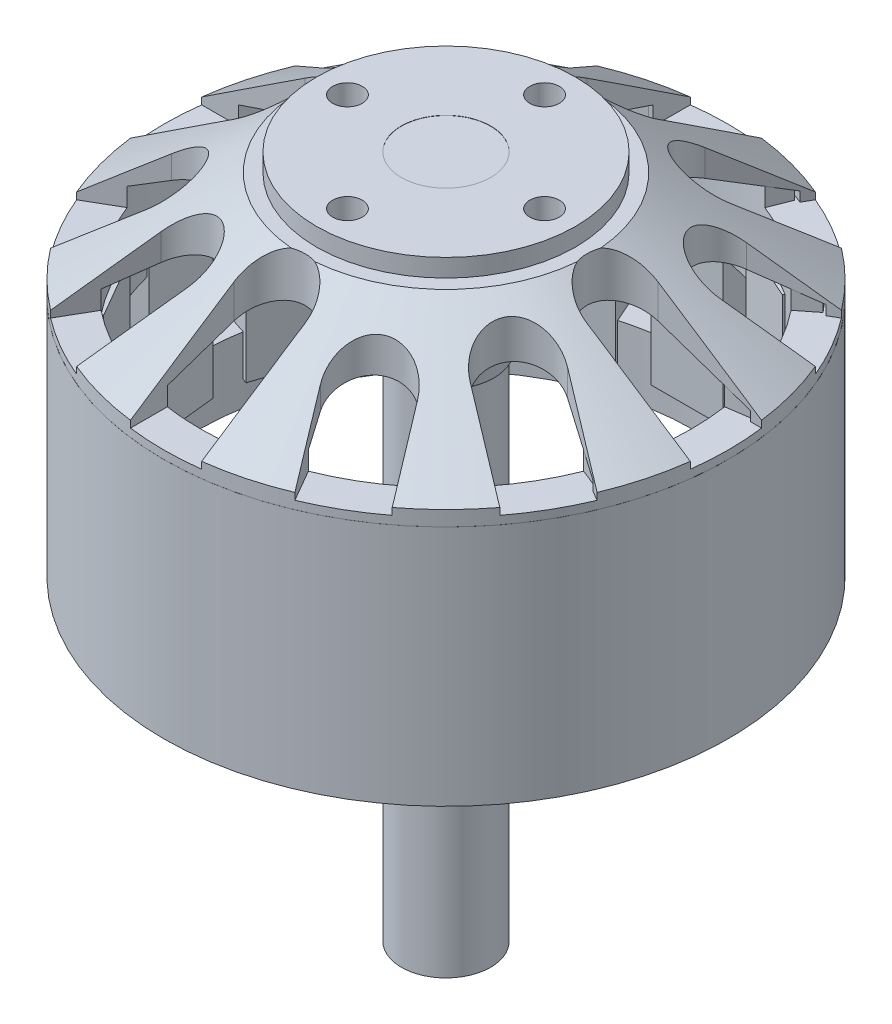
from build123d import *

# Parameters (mm, degrees)
SKETCH1_R               = 31.5
BOSS_EXTRUDE1_DEPTH     = 27
SKETCH2_R               = 16
BOSS_EXTRUDE2_DEPTH     = 12
SKETCH3_R               = 14.45
BOSS_EXTRUDE3_DEPTH     = 2
SKETCH5_R               = 31.495
BOSS_EXTRUDE5_DEPTH     = 1.68
SKETCH4_R               = 30.25
CUT_EXTRUDE3_DEPTH      = 29
SKETCH6_R               = 30.25
CUT_EXTRUDE4_DEPTH      = 5
CUT_EXTRUDE4_DRAFT      = -71
SKETCH7_R               = 7.5
BOSS_EXTRUDE6_DEPTH     = 12.192
BOSS_EXTRUDE6_TAPER     = 10
SKETCH8_R               = 4.98
BOSS_EXTRUDE7_DEPTH     = 57.15
SKETCH9_W               = 8
SKETCH9_H               = 3.077449872
BOSS_EXTRUDE8_DEPTH     = 23
SKETCH9_2_W             = 8
SKETCH9_2_H             = 3.077449872
CUT_EXTRUDE5_DEPTH      = 3
CIRPATTERN2_COUNT       = 15
CUT_EXTRUDE6_DEPTH      = 13.081
CIRPATTERN4_COUNT       = 4
SKETCH11_R              = 1.651
CUT_EXTRUDE7_DEPTH      = 7
CIRPATTERN5_COUNT       = 4
SKETCH11_3_R            = 4.98475
CUT_EXTRUDE8_DEPTH      = 0.0254
BOSS_EXTRUDE9_START     = -8.89
SKETCH12_R              = 30.25
SKETCH12_R_2            = 27.41332392
BOSS_EXTRUDE9_DEPTH     = 8.89
SKETCH13_R              = 30.25
SKETCH13_R_2            = 27.686
BOSS_EXTRUDE10_DEPTH    = 7.62
SKETCH13_2_R            = 30.25
SKETCH13_2_R_2          = 27.686
CUT_EXTRUDE9_DEPTH      = 0.254
EXTRUDE_THIN1_OUTLINE_W = 2.54
EXTRUDE_THIN1_OUTLINE_H = 2.93573008
EXTRUDE_THIN1_DEPTH     = 2.082149812
EXTRUDE_THIN1_3_DEPTH   = 0.930438526
EXTRUDE_THIN1_START     = 28.849438526
EXTRUDE_THIN1_4_DEPTH   = 1.127307378
CIRPATTERN8_COUNT       = 12


with BuildPart() as part:
    # Sketch1 → Boss-Extrude1 (new body)
    with BuildSketch(Plane(origin=(0, 0, 0), x_dir=(1, 0, 0), z_dir=(0, 1, 0))):
        with Locations(Location((0, 0, 0), (0, 0, 270))):
            Circle(SKETCH1_R)
    extrude(amount=BOSS_EXTRUDE1_DEPTH)

    # Sketch2 → Boss-Extrude2 (add)
    with BuildSketch(Plane(origin=(0, 27, 0), x_dir=(1, 0, 0), z_dir=(0, 1, 0))):
        with Locations(Location((0, 0, 0), (0, 0, 270))):
            Circle(SKETCH2_R)
    extrude(amount=BOSS_EXTRUDE2_DEPTH)

    # Sketch3 → Boss-Extrude3 (add)
    with BuildSketch(Plane(origin=(0, 39, 0), x_dir=(1, 0, 0), z_dir=(0, 1, 0))):
        with Locations(Location((0, 0, 0), (0, 0, 270))):
            Circle(SKETCH3_R)
    extrude(amount=BOSS_EXTRUDE3_DEPTH)

    # Sketch5 → Boss-Extrude5 (add)
    with BuildSketch(Plane(origin=(0, 27, 0), x_dir=(1, 0, 0), z_dir=(0, 1, 0))):
        with Locations(Location((0, 0, 0), (0, 0, 270))):
            Circle(SKETCH5_R)
    extrude(amount=BOSS_EXTRUDE5_DEPTH)

    # loft up to a face of the part (loft2)
    loft([Face(Wire([part.edges().sort_by_distance((22.958866921, 28.68, -21.559811101))[0]])), Face(Wire([part.edges().sort_by_distance((11.663498039, 39, -10.952753695))[0]]))])

    # Sketch4 → Cut-Extrude3 (cut)
    with BuildSketch(Plane.XZ):
        with Locations(Location((0, 0, 0), (0, 0, 270))):
            Circle(SKETCH4_R)
    extrude(amount=-CUT_EXTRUDE3_DEPTH, mode=Mode.SUBTRACT)


with BuildPart() as cut_extrude4_tool:
    # Sketch6 → Cut-Extrude4 (with draft: the straight prism first)
    with BuildSketch(Plane.XZ.offset(-29)):
        with Locations(Location((0, 0, 0), (0, 0, 270))):
            Circle(SKETCH6_R)
    extrude(amount=-CUT_EXTRUDE4_DEPTH)
    # Cut-Extrude4: the draft: its side faces are tilted about the plane it starts from
    cut_extrude4_sides = [cut_extrude4_tool.faces().sort_by_distance(p)[0] for p in [
        (0, 31.5, 30.25),
    ]]
    draft(cut_extrude4_sides, Plane.XZ.offset(-29), CUT_EXTRUDE4_DRAFT)


with BuildPart() as part_1:
    add(part.part)

    # Cut-Extrude4: cut by cut_extrude4_tool
    add(cut_extrude4_tool.part, mode=Mode.SUBTRACT)

    # Sketch7 → Boss-Extrude6 (add)
    with BuildSketch(Plane.XZ.offset(-34)):
        Circle(SKETCH7_R)
    extrude(amount=BOSS_EXTRUDE6_DEPTH, taper=BOSS_EXTRUDE6_TAPER)

    # Sketch8 → Boss-Extrude7 (add)
    with BuildSketch(Plane.XZ.offset(-21.808)):
        with Locations(Location((0, 0, 0), (0, 0, 270))):
            Circle(SKETCH8_R)
    extrude(amount=BOSS_EXTRUDE7_DEPTH)

    # Sketch10 → Cut-Extrude6 (cut)
    with BuildSketch(Plane(origin=(0, 41, 0), x_dir=(1, 0, 0), z_dir=(0, 1, 0))):
        with BuildLine():
            Line((-3.9751, 19.6951), (-3.9751, 33.358975787))
            Line((-3.9751, 33.358975787), (3.9751, 33.358975787))
            Line((3.9751, 33.358975787), (3.9751, 19.6951))
            ThreePointArc((3.9751, 19.6951), (0, 15.72), (-3.9751, 19.6951))
        make_face()
        with BuildLine():
            Line((7.671103378, 21.236940801), (14.604880277, 33.246594678))
            Line((14.604880277, 33.246594678), (21.661988499, 29.569464673))
            Line((21.661988499, 29.569464673), (14.556178543, 17.261840801))
            ThreePointArc((14.556178543, 17.261840801), (9.126090961, 15.806853218), (7.671103378, 21.236940801))
        make_face()
        with BuildLine():
            Line((18.368463718, 15.195087583), (36.379136438, 25.593554326))
            Line((36.379136438, 25.593554326), (40.354236438, 18.70847916))
            Line((40.354236438, 18.70847916), (22.343563718, 8.310012417))
            ThreePointArc((22.343563718, 8.310012417), (16.913476136, 9.765), (18.368463718, 15.195087583))
        make_face()
    cut_extrude6 = extrude(amount=-CUT_EXTRUDE6_DEPTH, mode=Mode.SUBTRACT)

    # CirPattern4: Cut-Extrude6 ×4 about axis
    cirpattern4_axis = Axis((0, 0, 0), (0, 1, 0))
    for i in range(1, CIRPATTERN4_COUNT):
        add(cut_extrude6.rotate(cirpattern4_axis, i * 360 / CIRPATTERN4_COUNT), mode=Mode.SUBTRACT)

    # Sketch11 → Cut-Extrude7 (cut)
    with BuildSketch(Plane(origin=(0, 41, 0), x_dir=(1, 0, 0), z_dir=(0, 1, 0))):
        with Locations(Location((0, 10.9982, 0), (0, 0, 270))):
            Circle(SKETCH11_R)
    cut_extrude7 = extrude(amount=-CUT_EXTRUDE7_DEPTH, mode=Mode.SUBTRACT)

    # CirPattern5: Cut-Extrude7 ×4 about axis
    cirpattern5_axis = Axis((0, 0, 0), (0, 1, 0))
    for i in range(1, CIRPATTERN5_COUNT):
        add(cut_extrude7.rotate(cirpattern5_axis, i * 360 / CIRPATTERN5_COUNT), mode=Mode.SUBTRACT)

    # Sketch11<3> → Cut-Extrude8 (cut)
    with BuildSketch(Plane(origin=(0, 41, 0), x_dir=(1, 0, 0), z_dir=(0, 1, 0))):
        with Locations(Location((0, 0, 0), (0, 0, 270))):
            Circle(SKETCH11_3_R)
    extrude(amount=-CUT_EXTRUDE8_DEPTH, mode=Mode.SUBTRACT)



with BuildPart() as body_2:
    # Sketch9 → Boss-Extrude8 (new body)
    with BuildSketch(Plane.XZ):
        with Locations((0, -28.438724936)):
            Rectangle(SKETCH9_W, SKETCH9_H)
    extrude(amount=-BOSS_EXTRUDE8_DEPTH)

    # Sketch9<2> → Cut-Extrude5 (cut)
    with BuildSketch(Plane.XZ):
        with Locations((0, -28.438724936)):
            Rectangle(SKETCH9_2_W, SKETCH9_2_H)
    extrude(amount=-CUT_EXTRUDE5_DEPTH, mode=Mode.SUBTRACT)


with BuildPart() as cirpattern2_1:
    # CirPattern2: pattern copy
    add(body_2.part.rotate(Axis((0, 0, 0), (0, 1, 0)), 1 * 360 / CIRPATTERN2_COUNT))


with BuildPart() as cirpattern2_2:
    # CirPattern2: pattern copy
    add(body_2.part.rotate(Axis((0, 0, 0), (0, 1, 0)), 2 * 360 / CIRPATTERN2_COUNT))


with BuildPart() as cirpattern2_3:
    # CirPattern2: pattern copy
    add(body_2.part.rotate(Axis((0, 0, 0), (0, 1, 0)), 3 * 360 / CIRPATTERN2_COUNT))


with BuildPart() as cirpattern2_4:
    # CirPattern2: pattern copy
    add(body_2.part.rotate(Axis((0, 0, 0), (0, 1, 0)), 4 * 360 / CIRPATTERN2_COUNT))


with BuildPart() as cirpattern2_5:
    # CirPattern2: pattern copy
    add(body_2.part.rotate(Axis((0, 0, 0), (0, 1, 0)), 5 * 360 / CIRPATTERN2_COUNT))


with BuildPart() as cirpattern2_6:
    # CirPattern2: pattern copy
    add(body_2.part.rotate(Axis((0, 0, 0), (0, 1, 0)), 6 * 360 / CIRPATTERN2_COUNT))


with BuildPart() as cirpattern2_7:
    # CirPattern2: pattern copy
    add(body_2.part.rotate(Axis((0, 0, 0), (0, 1, 0)), 7 * 360 / CIRPATTERN2_COUNT))


with BuildPart() as cirpattern2_8:
    # CirPattern2: pattern copy
    add(body_2.part.rotate(Axis((0, 0, 0), (0, 1, 0)), 8 * 360 / CIRPATTERN2_COUNT))


with BuildPart() as cirpattern2_9:
    # CirPattern2: pattern copy
    add(body_2.part.rotate(Axis((0, 0, 0), (0, 1, 0)), 9 * 360 / CIRPATTERN2_COUNT))


with BuildPart() as cirpattern2_10:
    # CirPattern2: pattern copy
    add(body_2.part.rotate(Axis((0, 0, 0), (0, 1, 0)), 10 * 360 / CIRPATTERN2_COUNT))


with BuildPart() as cirpattern2_11:
    # CirPattern2: pattern copy
    add(body_2.part.rotate(Axis((0, 0, 0), (0, 1, 0)), 11 * 360 / CIRPATTERN2_COUNT))


with BuildPart() as cirpattern2_12:
    # CirPattern2: pattern copy
    add(body_2.part.rotate(Axis((0, 0, 0), (0, 1, 0)), 12 * 360 / CIRPATTERN2_COUNT))


with BuildPart() as cirpattern2_13:
    # CirPattern2: pattern copy
    add(body_2.part.rotate(Axis((0, 0, 0), (0, 1, 0)), 13 * 360 / CIRPATTERN2_COUNT))


with BuildPart() as cirpattern2_14:
    # CirPattern2: pattern copy
    add(body_2.part.rotate(Axis((0, 0, 0), (0, 1, 0)), 14 * 360 / CIRPATTERN2_COUNT))


with BuildPart() as part_2:
    add(part_1.part)

    add(body_2.part)  # Boss-Extrude9 merges body 2

    add(cirpattern2_1.part)  # Boss-Extrude9 merges CirPattern2_1

    add(cirpattern2_2.part)  # Boss-Extrude9 merges CirPattern2_2

    add(cirpattern2_3.part)  # Boss-Extrude9 merges CirPattern2_3

    add(cirpattern2_4.part)  # Boss-Extrude9 merges CirPattern2_4

    add(cirpattern2_5.part)  # Boss-Extrude9 merges CirPattern2_5

    add(cirpattern2_6.part)  # Boss-Extrude9 merges CirPattern2_6

    add(cirpattern2_7.part)  # Boss-Extrude9 merges CirPattern2_7

    add(cirpattern2_8.part)  # Boss-Extrude9 merges CirPattern2_8

    add(cirpattern2_9.part)  # Boss-Extrude9 merges CirPattern2_9

    add(cirpattern2_10.part)  # Boss-Extrude9 merges CirPattern2_10

    add(cirpattern2_11.part)  # Boss-Extrude9 merges CirPattern2_11

    add(cirpattern2_12.part)  # Boss-Extrude9 merges CirPattern2_12

    add(cirpattern2_13.part)  # Boss-Extrude9 merges CirPattern2_13

    add(cirpattern2_14.part)  # Boss-Extrude9 merges CirPattern2_14
    # Sketch12 → Boss-Extrude9 (add)
    with BuildSketch(Plane(origin=(0, 27.919, 0), x_dir=(1, 0, 0), z_dir=(0, 1, 0)).offset(BOSS_EXTRUDE9_START)):
        with Locations(Location((0, 0, 0), (0, 0, 90))):
            Circle(SKETCH12_R)
        with Locations(Location((0, 0, 0), (0, 0, 270))):
            Circle(SKETCH12_R_2, mode=Mode.SUBTRACT)
    extrude(amount=BOSS_EXTRUDE9_DEPTH)

    # Sketch13 → Boss-Extrude10 (add)
    with BuildSketch(Plane.XZ):
        with Locations(Location((0, 0, 0), (0, 0, 270))):
            Circle(SKETCH13_R)
        with Locations(Location((0, 0, 0), (0, 0, 270))):
            Circle(SKETCH13_R_2, mode=Mode.SUBTRACT)
    extrude(amount=-BOSS_EXTRUDE10_DEPTH)

    # Sketch13<2> → Cut-Extrude9 (cut)
    with BuildSketch(Plane.XZ):
        with Locations(Location((0, 0, 0), (0, 0, 270))):
            Circle(SKETCH13_2_R)
        with Locations(Location((0, 0, 0), (0, 0, 270))):
            Circle(SKETCH13_2_R_2, mode=Mode.SUBTRACT)
    extrude(amount=-CUT_EXTRUDE9_DEPTH, mode=Mode.SUBTRACT)


with BuildPart() as body_2_2:
    # Extrude-Thin1: read off the stored shape, not the designer's step
    # Extrude-Thin1 outline → Extrude-Thin1 (new body)
    with BuildSketch(Plane(origin=(0, 27.919, 0), x_dir=(1, 0, 0), z_dir=(0, 1, 0))):
        with Locations((-5.2451, 28.519817098)):
            Rectangle(EXTRUDE_THIN1_OUTLINE_W, EXTRUDE_THIN1_OUTLINE_H)
    extrude(amount=EXTRUDE_THIN1_DEPTH)

    # Extrude-Thin1 2 outline → Extrude-Thin1 2 (revolve, cut)
    with BuildSketch(Plane.XY):
        Polygon((30.687254814, 30.001149812), (27.342449235, 30.001149812), (30.687255251, 28.849440943), align=None)
    revolve(axis=Axis((0, 0, 0), (0, 1, 0)), mode=Mode.SUBTRACT)


with BuildPart() as body_3:
    # Extrude-Thin1 3 outline → Extrude-Thin1 3 (new body)
    with BuildSketch(Plane(origin=(0, 27.919, 0), x_dir=(1, 0, 0), z_dir=(0, 1, 0))):
        with BuildLine():
            Line((-8.975855287, 28.576837399), (-9.351598961, 29.227644532))
            Line((-9.351598961, 29.227644532), (-11.551303486, 27.957644532))
            Line((-11.551303486, 27.957644532), (-10.119255333, 25.477264372))
            ThreePointArc((-10.119255333, 25.477264372), (-7.09509032, 26.479237559), (-3.9751, 27.123585831))
            Line((-3.9751, 27.123585831), (-4.343415569, 29.636739953))
            ThreePointArc((-4.343415569, 29.636739953), (-6.680688018, 29.198801713), (-8.975855287, 28.576837399))
        make_face()
    extrude(amount=EXTRUDE_THIN1_3_DEPTH)

    # Extrude-Thin1 4 outline → Extrude-Thin1 4 (add)
    with BuildSketch(Plane(origin=(0, 0, 0), x_dir=(1, 0, 0), z_dir=(0, 1, 0)).offset(EXTRUDE_THIN1_START)):
        with BuildLine():
            Line((-8.975855287, 28.576837399), (-9.351598961, 29.227644532))
            Line((-9.351598961, 29.227644532), (-11.551303486, 27.957644532))
            Line((-11.551303486, 27.957644532), (-10.119255333, 25.477264372))
            ThreePointArc((-10.119255333, 25.477264372), (-7.09509032, 26.479237559), (-3.9751, 27.123585831))
            Line((-3.9751, 27.123585831), (-4.343415569, 29.636739953))
            ThreePointArc((-4.343415569, 29.636739953), (-6.680688018, 29.198801713), (-8.975855287, 28.576837399))
        make_face()
    extrude(amount=EXTRUDE_THIN1_4_DEPTH)

    # Extrude-Thin1 5 outline → Extrude-Thin1 5 (revolve, cut)
    with BuildSketch(Plane.XY):
        Polygon((30.687254814, 29.976745904), (27.41332392, 29.976745904), (30.687255539, 28.849440844), align=None)
    revolve(axis=Axis((0, 0, 0), (0, 1, 0)), mode=Mode.SUBTRACT)


with BuildPart() as cirpattern8_1:
    # CirPattern8: pattern copy
    add(body_3.part.rotate(Axis((0, -35.342, 0), (0, 1, 0)), 1 * 360 / CIRPATTERN8_COUNT))


with BuildPart() as cirpattern8_2:
    # CirPattern8: pattern copy
    add(body_3.part.rotate(Axis((0, -35.342, 0), (0, 1, 0)), 2 * 360 / CIRPATTERN8_COUNT))


with BuildPart() as cirpattern8_3:
    # CirPattern8: pattern copy
    add(body_3.part.rotate(Axis((0, -35.342, 0), (0, 1, 0)), 3 * 360 / CIRPATTERN8_COUNT))


with BuildPart() as cirpattern8_4:
    # CirPattern8: pattern copy
    add(body_3.part.rotate(Axis((0, -35.342, 0), (0, 1, 0)), 4 * 360 / CIRPATTERN8_COUNT))


with BuildPart() as cirpattern8_5:
    # CirPattern8: pattern copy
    add(body_3.part.rotate(Axis((0, -35.342, 0), (0, 1, 0)), 5 * 360 / CIRPATTERN8_COUNT))


with BuildPart() as cirpattern8_6:
    # CirPattern8: pattern copy
    add(body_3.part.rotate(Axis((0, -35.342, 0), (0, 1, 0)), 6 * 360 / CIRPATTERN8_COUNT))


with BuildPart() as cirpattern8_7:
    # CirPattern8: pattern copy
    add(body_3.part.rotate(Axis((0, -35.342, 0), (0, 1, 0)), 7 * 360 / CIRPATTERN8_COUNT))


with BuildPart() as cirpattern8_8:
    # CirPattern8: pattern copy
    add(body_3.part.rotate(Axis((0, -35.342, 0), (0, 1, 0)), 8 * 360 / CIRPATTERN8_COUNT))


with BuildPart() as cirpattern8_9:
    # CirPattern8: pattern copy
    add(body_3.part.rotate(Axis((0, -35.342, 0), (0, 1, 0)), 9 * 360 / CIRPATTERN8_COUNT))


with BuildPart() as cirpattern8_10:
    # CirPattern8: pattern copy
    add(body_3.part.rotate(Axis((0, -35.342, 0), (0, 1, 0)), 10 * 360 / CIRPATTERN8_COUNT))


with BuildPart() as cirpattern8_11:
    # CirPattern8: pattern copy
    add(body_3.part.rotate(Axis((0, -35.342, 0), (0, 1, 0)), 11 * 360 / CIRPATTERN8_COUNT))


with BuildPart() as part_3:
    add(part_2.part)

    # Combine1: union body 3, body 2 2, CirPattern8_1, CirPattern8_2, CirPattern8_3, CirPattern8_4, CirPattern8_5, CirPattern8_6, CirPattern8_7, CirPattern8_8, CirPattern8_9, CirPattern8_10, CirPattern8_11
    add(body_3.part)
    add(body_2_2.part)
    add(cirpattern8_1.part)
    add(cirpattern8_2.part)
    add(cirpattern8_3.part)
    add(cirpattern8_4.part)
    add(cirpattern8_5.part)
    add(cirpattern8_6.part)
    add(cirpattern8_7.part)
    add(cirpattern8_8.part)
    add(cirpattern8_9.part)
    add(cirpattern8_10.part)
    add(cirpattern8_11.part)


solid = part_3.part
